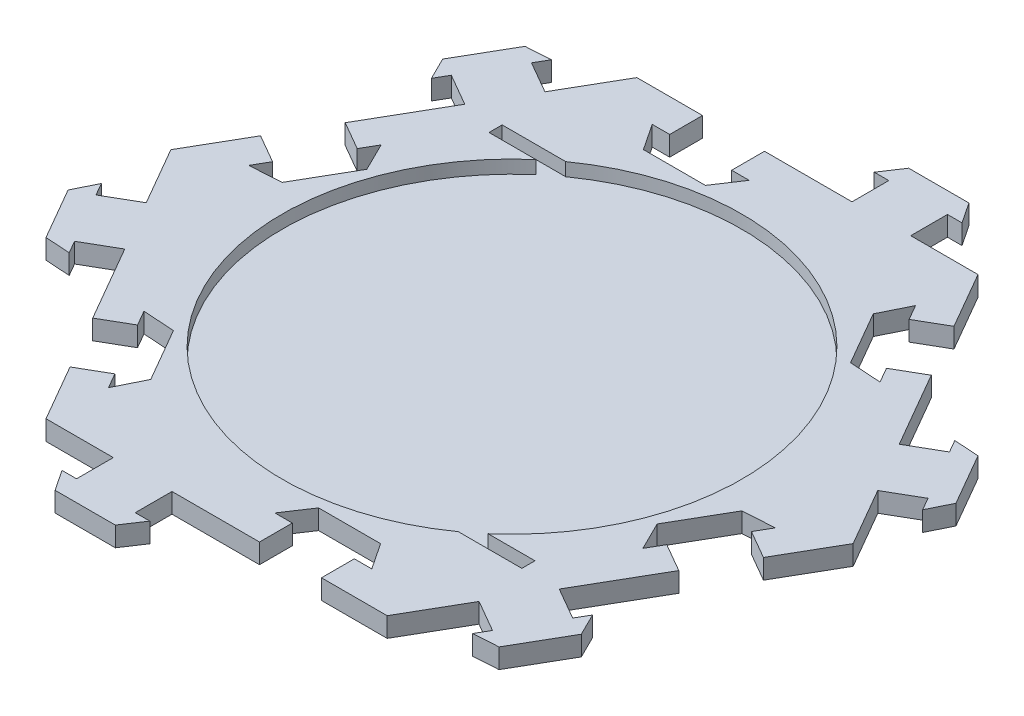
from build123d import *

# Parameters (mm, degrees)
SKETCH1_R               = 35
BOSS_EXTRUDE1_DEPTH     = 3
SKETCH1_3_R             = 35
BOSS_EXTRUDE2_DEPTH     = 1
SKETCH2_W               = 30
SKETCH2_H               = 2
CUT_EXTRUDE_THIN1_DEPTH = 10


with BuildPart() as part:
    # Sketch1 → Boss-Extrude1 (new body)
    with BuildSketch(Plane(origin=(0, 0, 0), x_dir=(1, 0, 0), z_dir=(0, 1, 0))):
        Polygon((-15.980762114, 40), (-15.980762114, 45), (-25.980762114, 45), (-31.105762114, 36.123239611), (-35.955504375, 38.923239611), (-34.84856934, 40.840507331), (-38.62542222, 40.598806252), (-43.211790111, 32.654984042), (-41.532682946, 29.263282963), (-40.425747912, 31.180550683), (-35.576005651, 28.380550683), (-42.24128069, 16.835955668), (-37.911153671, 14.335955668), (-36.57925163, 16.642877674), (-34.447052056, 12.335955668), (-39.167295593, 4.160254038), (-43.963299249, 3.853332032), (-42.631397208, 6.160254038), (-46.961524227, 8.660254038), (-51.961524227, 0), (-46.836524227, -8.876760389), (-51.686266488, -11.676760389), (-52.793201523, -9.759492669), (-54.472308687, -13.151193748), (-49.885940796, -21.095015958), (-46.109087917, -21.336717037), (-47.216022951, -19.419449317), (-42.36628069, -16.619449317), (-35.701005651, -28.164044332), (-31.370878632, -25.664044332), (-32.702780673, -23.357122326), (-27.906777016, -23.664044332), (-23.186533479, -31.839745962), (-25.318733054, -36.146667968), (-26.650635095, -33.839745962), (-30.980762114, -36.339745962), (-25.980762114, -45), (-15.730762114, -45), (-15.730762114, -50.6), (-17.944632182, -50.6), (-15.846886468, -53.75), (-6.674150685, -53.75), (-4.576404971, -50.6), (-6.790275039, -50.6), (-6.790275039, -45), (6.540275039, -45), (6.540275039, -40), (3.876470958, -40), (6.540275039, -36), (15.980762114, -36), (18.644566195, -40), (15.980762114, -40), (15.980762114, -45), (25.980762114, -45), (31.105762114, -36.123239611), (35.955504375, -38.923239611), (34.84856934, -40.840507331), (38.62542222, -40.598806252), (43.211790111, -32.654984042), (41.532682946, -29.263282963), (40.425747912, -31.180550683), (35.576005651, -28.380550683), (42.24128069, -16.835955668), (37.911153671, -14.335955668), (36.57925163, -16.642877674), (34.447052056, -12.335955668), (39.167295593, -4.160254038), (43.963299249, -3.853332032), (42.631397208, -6.160254038), (46.961524227, -8.660254038), (51.961524227, 0), (46.836524227, 8.876760389), (51.686266488, 11.676760389), (52.793201523, 9.759492669), (54.472308687, 13.151193748), (49.885940796, 21.095015958), (46.109087917, 21.336717037), (47.216022951, 19.419449317), (42.36628069, 16.619449317), (35.701005651, 28.164044332), (31.370878632, 25.664044332), (32.702780673, 23.357122326), (27.906777016, 23.664044332), (23.186533479, 31.839745962), (25.318733054, 36.146667968), (26.650635095, 33.839745962), (30.980762114, 36.339745962), (25.980762114, 45), (15.730762114, 45), (15.730762114, 50.6), (17.944632182, 50.6), (15.846886468, 53.75), (6.674150685, 53.75), (4.576404971, 50.6), (6.790275039, 50.6), (6.790275039, 45), (-6.540275039, 45), (-6.540275039, 40), (-3.876470958, 40), (-6.540275039, 36), (-15.980762114, 36), (-18.644566195, 40), align=None)
        Circle(SKETCH1_R, mode=Mode.SUBTRACT)
    extrude(amount=BOSS_EXTRUDE1_DEPTH)

    # Sketch1<3> → Boss-Extrude2 (add)
    with BuildSketch(Plane(origin=(0, 0, 0), x_dir=(1, 0, 0), z_dir=(0, 1, 0))):
        Circle(SKETCH1_3_R)
    extrude(amount=BOSS_EXTRUDE2_DEPTH)

    # Sketch2 → Cut-Extrude-Thin1 (cut)
    with BuildSketch(Plane(origin=(0, 1, 0), x_dir=(1, 0, 0), z_dir=(0, 1, 0))):
        with Locations((-15, 27.5)):
            Rectangle(SKETCH2_W, SKETCH2_H)
        with Locations((15, -27.5)):
            Rectangle(SKETCH2_W, SKETCH2_H)
    extrude(amount=CUT_EXTRUDE_THIN1_DEPTH, mode=Mode.SUBTRACT)


solid = part.part
